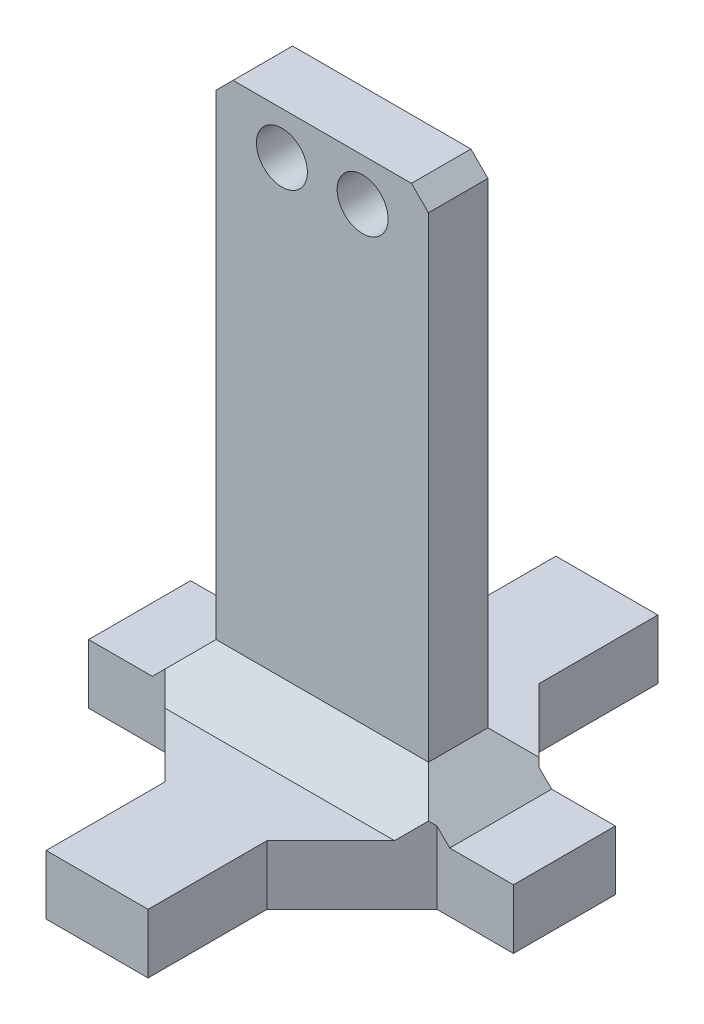
from build123d import *

# Parameters (mm, degrees)
SKETCH1_W           = 25
SKETCH1_H           = 70
SKETCH1_R           = 3
BOSS_EXTRUDE1_DEPTH = 7
SKETCH2_W           = 12
SKETCH2_H           = 24
SKETCH2_H_2         = 7
SKETCH2_W_2         = 6.5
SKETCH2_H_3         = 2.5
BOSS_EXTRUDE2_DEPTH = 7
CHAMFER2_SIZE       = 10
CHAMFER3_SIZE       = 5
CHAMFER4_SIZE       = 5
CHAMFER5_SIZE       = 2


with BuildPart() as part:
    # Sketch1 → Boss-Extrude1 (new body)
    with BuildSketch(Plane.XY):
        with Locations((12.5, 35)):
            Rectangle(SKETCH1_W, SKETCH1_H)
        with Locations((7.75, 65)):
            Circle(SKETCH1_R, mode=Mode.SUBTRACT)
        with Locations((17.25, 65)):
            Circle(SKETCH1_R, mode=Mode.SUBTRACT)
    extrude(amount=BOSS_EXTRUDE1_DEPTH)

    # Sketch2 → Boss-Extrude2 (add)
    with BuildSketch(Plane.XZ):
        with Locations((12.5, 21.5)):
            Rectangle(SKETCH2_W, SKETCH2_H)
        Polygon((6.5, 7), (6.5, 9.5), (-12.5, 9.5), (-12.5, -2.5), (6.5, -2.5), (6.5, 0), (0, 0), (0, 7), align=None)
        with Locations((12.5, 3.5)):
            Rectangle(SKETCH2_W, SKETCH2_H_2)
        Polygon((37.5, 9.5), (18.5, 9.5), (18.5, 7), (25, 7), (25, 0), (18.5, 0), (18.5, -2.5), (37.5, -2.5), align=None)
        with Locations((12.5, -14.5)):
            Rectangle(SKETCH2_W, SKETCH2_H)
        with Locations((3.25, 3.5)):
            Rectangle(SKETCH2_W_2, SKETCH2_H_2)
        with Locations((12.5, 8.25)):
            Rectangle(SKETCH2_W, SKETCH2_H_3)
        with Locations((12.5, -1.25)):
            Rectangle(SKETCH2_W, SKETCH2_H_3)
        with Locations((21.75, 3.5)):
            Rectangle(SKETCH2_W_2, SKETCH2_H_2)
    extrude(amount=-BOSS_EXTRUDE2_DEPTH)

    # Chamfer2
    chamfer2_edges = [part.edges().sort_by_distance(p)[0] for p in [
        (18.5, 3.5, 9.5),
        (18.5, 3.5, -2.5),
        (6.5, 3.5, -2.5),
        (6.5, 3.5, 9.5),
    ]]
    chamfer(chamfer2_edges, length=CHAMFER2_SIZE)

    # Chamfer3
    chamfer3_edges = [part.edges().sort_by_distance(p)[0] for p in [
        (12.5, 7, 7),
        (12.5, 7, 0),
    ]]
    chamfer(chamfer3_edges, length=CHAMFER3_SIZE)

    # Chamfer4
    # the kernel refuses this chamfer: 5 mm, written as the material it adds along each edge
    with BuildSketch(Plane(origin=(25, 7, -17.85841494), x_dir=(0.9996219169112968, -0.027495876610586317, 0), z_dir=(0, 0, 1))) as chamfer4_piece_1_section:
        Polygon((CHAMFER4_SIZE * 0.999621916911, CHAMFER4_SIZE * 0.0274958766106), (-CHAMFER4_SIZE * 0.0274958766106, CHAMFER4_SIZE * 0.999621916911), (0, 0), align=None)
    chamfer4_piece_1 = extrude(amount=42.71682988, mode=Mode.PRIVATE)
    chamfer4_piece_1 = split(chamfer4_piece_1, bisect_by=Plane(origin=(26.380997475, 7.88604798, 9.5), z_dir=(0, 0, -1)), keep=Keep.TOP, mode=Mode.PRIVATE)
    chamfer4_piece_1 = split(chamfer4_piece_1, bisect_by=Plane(origin=(27.086016414, 7.88604798, -3.913983586), z_dir=(-0.7071067811865475, 0, 0.7071067811865477)), keep=Keep.TOP, mode=Mode.PRIVATE)
    chamfer4_piece_1 = split(chamfer4_piece_1, bisect_by=Plane(origin=(26.380997475, 8.338541667, -3.661458333), z_dir=(0, -0.7071067811865476, 0.7071067811865476)), keep=Keep.TOP, mode=Mode.PRIVATE)
    chamfer4_piece_1 = split(chamfer4_piece_1, bisect_by=Plane(origin=(26.380997475, 15.047506313, 3.952493687), z_dir=(0, -0.7071067811865476, -0.7071067811865476)), keep=Keep.TOP, mode=Mode.PRIVATE)
    add(chamfer4_piece_1)
    with BuildSketch(Plane(origin=(25, 7, -17.85841494), x_dir=(0.9996219169112968, -0.027495876610586317, 0), z_dir=(0, 0, 1))) as chamfer4_piece_2_section:
        Polygon((CHAMFER4_SIZE * 0.999621916911, CHAMFER4_SIZE * 0.0274958766106), (-CHAMFER4_SIZE * 0.0274958766106, CHAMFER4_SIZE * 0.999621916911), (0, 0), align=None)
    chamfer4_piece_2 = extrude(amount=42.71682988, mode=Mode.PRIVATE)
    chamfer4_piece_2 = split(chamfer4_piece_2, bisect_by=Plane(origin=(34.6875, 7.375, 3.3125), z_dir=(-0.7071067811865475, 0, -0.7071067811865477)), keep=Keep.TOP, mode=Mode.PRIVATE)
    chamfer4_piece_2 = split(chamfer4_piece_2, bisect_by=Plane(origin=(29.25, 7.375, -2.5), z_dir=(0, 0, 1)), keep=Keep.TOP, mode=Mode.PRIVATE)
    chamfer4_piece_2 = split(chamfer4_piece_2, bisect_by=Plane(origin=(29.25, 8.625, -3.375), z_dir=(0, -0.7071067811865476, 0.7071067811865476)), keep=Keep.TOP, mode=Mode.PRIVATE)
    chamfer4_piece_2 = split(chamfer4_piece_2, bisect_by=Plane(origin=(29.25, 14.25, 4.75), z_dir=(0, -0.7071067811865476, -0.7071067811865476)), keep=Keep.TOP, mode=Mode.PRIVATE)
    add(chamfer4_piece_2)
    with BuildSketch(Plane(origin=(0, 7, 24.85841494), x_dir=(-0.9996219169112968, -0.027495876610586317, 0), z_dir=(0, 0, -1))) as chamfer4_piece_3_section:
        Polygon((CHAMFER4_SIZE * 0.999621916911, CHAMFER4_SIZE * 0.0274958766106), (-CHAMFER4_SIZE * 0.0274958766106, CHAMFER4_SIZE * 0.999621916911), (0, 0), align=None)
    chamfer4_piece_3 = extrude(amount=42.71682988, mode=Mode.PRIVATE)
    chamfer4_piece_3 = split(chamfer4_piece_3, bisect_by=Plane(origin=(-2.086016414, 7.88604798, 10.913983586), z_dir=(0.7071067811865477, 0, -0.7071067811865475)), keep=Keep.TOP, mode=Mode.PRIVATE)
    chamfer4_piece_3 = split(chamfer4_piece_3, bisect_by=Plane(origin=(-1.380997475, 7.88604798, -2.5), z_dir=(0, 0, 1)), keep=Keep.TOP, mode=Mode.PRIVATE)
    chamfer4_piece_3 = split(chamfer4_piece_3, bisect_by=Plane(origin=(-1.380997475, 15.047506313, 3.047506313), z_dir=(0, -0.7071067811865476, 0.7071067811865476)), keep=Keep.TOP, mode=Mode.PRIVATE)
    chamfer4_piece_3 = split(chamfer4_piece_3, bisect_by=Plane(origin=(-1.380997475, 8.338541667, 10.661458333), z_dir=(0, -0.7071067811865476, -0.7071067811865476)), keep=Keep.TOP, mode=Mode.PRIVATE)
    add(chamfer4_piece_3)
    with BuildSketch(Plane(origin=(0, 7, 24.85841494), x_dir=(-0.9996219169112968, -0.027495876610586317, 0), z_dir=(0, 0, -1))) as chamfer4_piece_4_section:
        Polygon((CHAMFER4_SIZE * 0.999621916911, CHAMFER4_SIZE * 0.0274958766106), (-CHAMFER4_SIZE * 0.0274958766106, CHAMFER4_SIZE * 0.999621916911), (0, 0), align=None)
    chamfer4_piece_4 = extrude(amount=42.71682988, mode=Mode.PRIVATE)
    chamfer4_piece_4 = split(chamfer4_piece_4, bisect_by=Plane(origin=(-4.25, 7.375, 9.5), z_dir=(0, 0, -1)), keep=Keep.TOP, mode=Mode.PRIVATE)
    chamfer4_piece_4 = split(chamfer4_piece_4, bisect_by=Plane(origin=(-9.6875, 7.375, 3.6875), z_dir=(0.7071067811865476, 0, 0.7071067811865475)), keep=Keep.TOP, mode=Mode.PRIVATE)
    chamfer4_piece_4 = split(chamfer4_piece_4, bisect_by=Plane(origin=(-4.25, 14.25, 2.25), z_dir=(0, -0.7071067811865476, 0.7071067811865476)), keep=Keep.TOP, mode=Mode.PRIVATE)
    chamfer4_piece_4 = split(chamfer4_piece_4, bisect_by=Plane(origin=(-4.25, 8.625, 10.375), z_dir=(0, -0.7071067811865476, -0.7071067811865476)), keep=Keep.TOP, mode=Mode.PRIVATE)
    add(chamfer4_piece_4)

    # Chamfer5
    chamfer5_edges = [part.edges().sort_by_distance(p)[0] for p in [
        (0, 70, 3.5),
        (25, 70, 3.5),
    ]]
    chamfer(chamfer5_edges, length=CHAMFER5_SIZE)


solid = part.part
